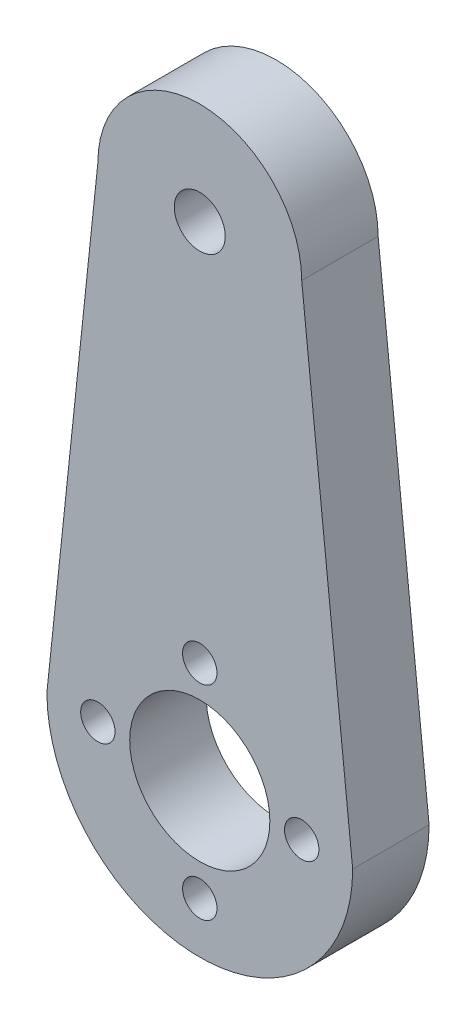
from build123d import *

# Parameters (mm, degrees)
BOSS_EXTRU_1_DEPTH           = 6
ENL_V_MAT_EXTRU_1_DEPTH      = 48.916594203
ENL_V_MAT_EXTRU_1_DEPTH_BACK = 48.916594203
ESQUISSE2_R                  = 5.5
ESQUISSE2_R_2                = 1.35
ESQUISSE2_R_3                = 2


with BuildPart() as part:
    # Esquisse1 → Boss.-Extru.1 (new body)
    with BuildSketch(Plane.XY):
        with BuildLine():
            Line((12, 0), (8, 38))
            ThreePointArc((8, 38), (0, 46), (-8, 38))
            Line((-8, 38), (-12, 0))
            ThreePointArc((-12, 0), (0, -12), (12, 0))
        make_face()
    extrude(amount=BOSS_EXTRU_1_DEPTH)

    # Esquisse2 → Enlèv. mat.-Extru.1 (cut, two sides: drawn at the far end of the back side and taken through both)
    with BuildSketch(Plane.XY.offset(6).offset(-ENL_V_MAT_EXTRU_1_DEPTH_BACK)):
        Circle(ESQUISSE2_R)
        with Locations((8, 0)):
            Circle(ESQUISSE2_R_2)
        with Locations((0, -8)):
            Circle(ESQUISSE2_R_2)
        with Locations((-8, 0)):
            Circle(ESQUISSE2_R_2)
        with Locations((0, 8)):
            Circle(ESQUISSE2_R_2)
        with Locations((0, 38)):
            Circle(ESQUISSE2_R_3)
    extrude(amount=ENL_V_MAT_EXTRU_1_DEPTH + ENL_V_MAT_EXTRU_1_DEPTH_BACK, mode=Mode.SUBTRACT)


solid = part.part
